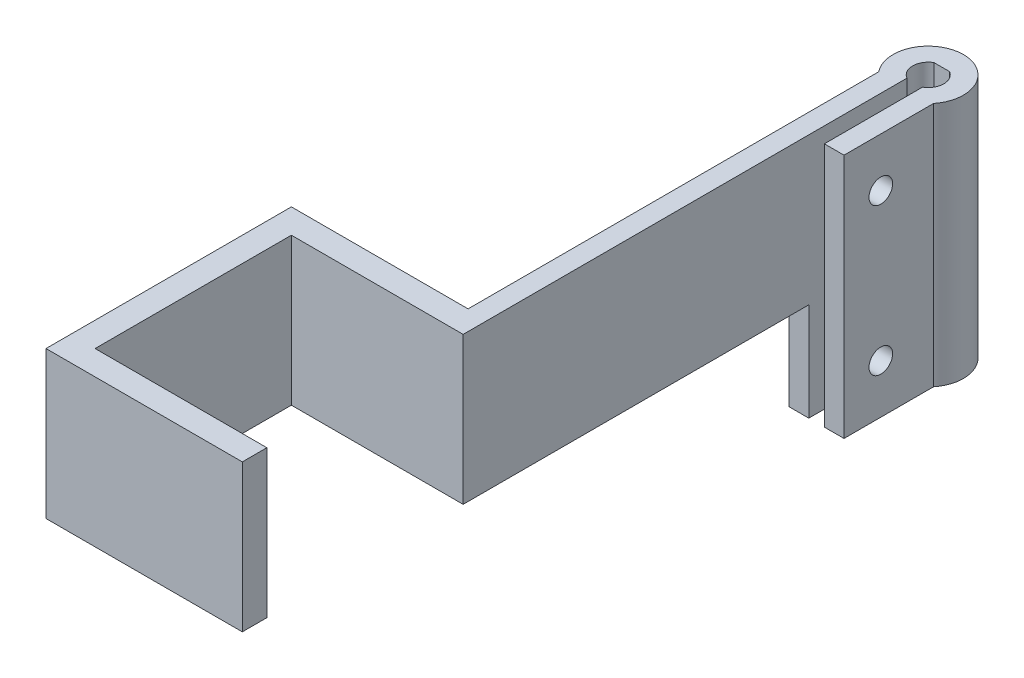
from build123d import *

# Parameters (mm, degrees)
BOSS_EXTRUDE1_DEPTH  = 50
BOSS_EXTRUDE2_DEPTH  = 30
M4_CLEARANCE_HOLE1_D = 4.8


with BuildPart() as part:
    # Sketch1 → Boss-Extrude1 (new body)
    with BuildSketch(Plane(origin=(0, 0, 0), x_dir=(1, 0, 0), z_dir=(0, 1, 0))):
        with BuildLine():
            Line((-1.5875, -2.749630657), (-1.5875, -22.749630657))
            Line((-1.5875, -22.749630657), (-5.5875, -22.749630657))
            Line((-5.5875, -22.749630657), (-5.5875, -4.501163044))
            ThreePointArc((-5.5875, -4.501163044), (0, 7.175), (5.5875, -4.501163044))
            Line((5.5875, -4.501163044), (5.5875, -22.749630657))
            Line((5.5875, -22.749630657), (1.5875, -22.749630657))
            Line((1.5875, -22.749630657), (1.5875, -2.749630657))
            ThreePointArc((1.5875, -2.749630657), (3.175, 0), (1.5875, 2.749630657))
            Line((1.5875, 2.749630657), (-1.5875, 2.749630657))
            ThreePointArc((-1.5875, 2.749630657), (-3.175, 0), (-1.5875, -2.749630657))
        make_face()
    extrude(amount=BOSS_EXTRUDE1_DEPTH)

    # Sketch5 → Boss-Extrude2 (add)
    with BuildSketch(Plane(origin=(0, 50, 0), x_dir=(1, 0, 0), z_dir=(0, 1, 0))):
        Polygon((-41.5875, -88.175), (-41.5875, -138.175), (-1.5875, -138.175), (-1.5875, -133.175), (-36.5875, -133.175), (-36.5875, -93.175), (-1.5875, -93.175), (-1.5875, -22.749630657), (-5.5875, -22.749630657), (-5.5875, -88.175), align=None)
    extrude(amount=-BOSS_EXTRUDE2_DEPTH)

    # M4 Clearance Hole1 (through all)
    with Locations(Plane(origin=(5.5875, 0, 0), x_dir=(0, 0, -1), z_dir=(1, 0, 0))):
        with Locations((-15.249630657, 40), (-15.249630657, 10)):
            Hole(M4_CLEARANCE_HOLE1_D / 2)


solid = part.part
